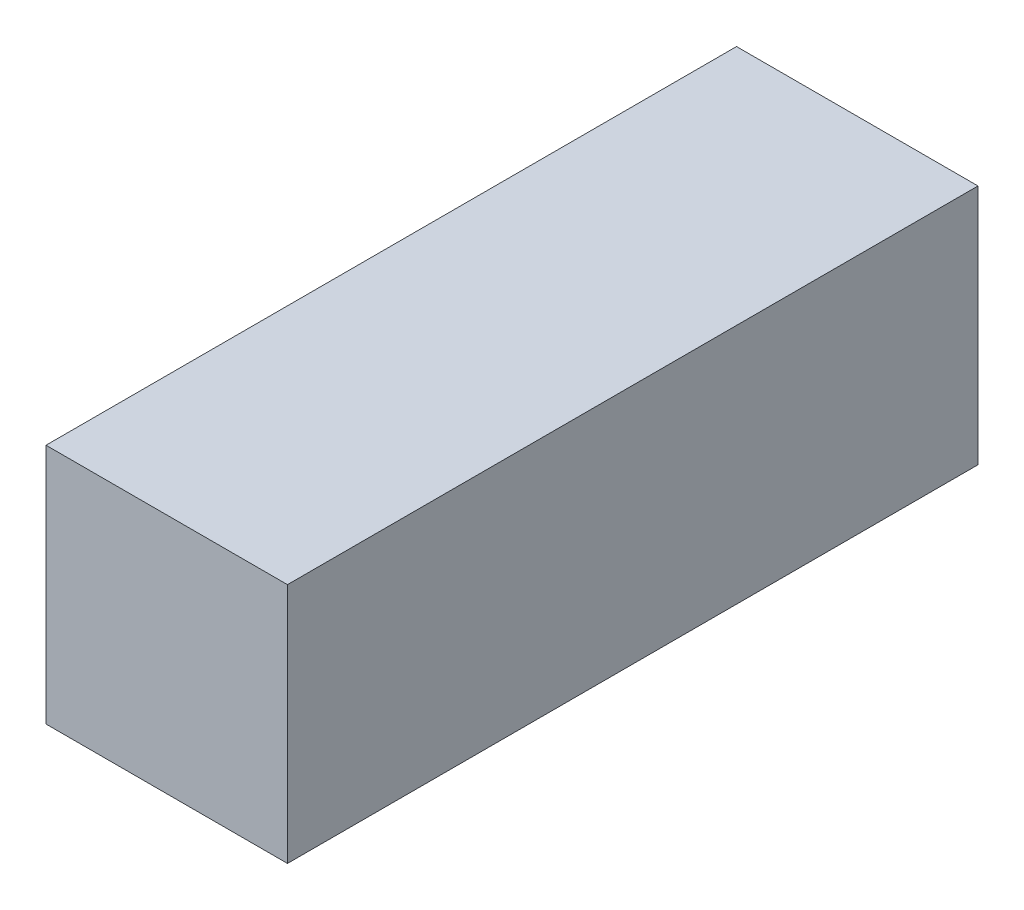
from build123d import *

# Parameters (mm, degrees)
SKETCH1_W                = 57.15
SKETCH1_H                = 19.05
BOSS_EXTRUDE1_DEPTH      = 9.525
CUT_EXTRUDE3_DEPTH       = 32.629374859
CUT_EXTRUDE3_DEPTH_BACK  = 32.629374859
SKETCH2_OUTSIDE_W        = 71.786
SKETCH2_OUTSIDE_H        = 33.686
SKETCH7_R                = 6.604
CUT_EXTRUDE6_DEPTH       = 6.477
SKETCH11_R               = 6.604
CUT_EXTRUDE10_DEPTH      = 1.6764
SKETCH8_R                = 6.604
CUT_EXTRUDE7_DEPTH       = 3.556
CUT_EXTRUDE8_START       = -3.556
SKETCH9_R                = 6.604
CUT_EXTRUDE8_DEPTH       = 3.556
CUT_EXTRUDE9_DEPTH       = 32.629374859
CUT_EXTRUDE9_DEPTH_BACK  = 32.629374859
SKETCH10_R               = 1.5875
SKETCH10_R_2             = 3.175
CUT_EXTRUDE11_DEPTH      = 32.629374859
CUT_EXTRUDE11_DEPTH_BACK = 32.629374859
SKETCH12_W               = 3.3528
SKETCH12_H               = 6.477
CUT_EXTRUDE12_DEPTH      = 32.629374859
CUT_EXTRUDE12_DEPTH_BACK = 32.629374859
SKETCH13_R               = 0.79375
SKETCH13_W               = 24.984827435
SKETCH13_H               = 3.3528
CUT_EXTRUDE13_DEPTH      = 1.5875
CUT_EXTRUDE14_DEPTH      = 32.629374859
CUT_EXTRUDE14_DEPTH_BACK = 32.629374859
SKETCH16_R               = 0.79375
FILLET1_R                = 3.175
CUT_EXTRUDE15_DEPTH      = 32.62937489
CUT_EXTRUDE15_DEPTH_BACK = 32.62937489
SKETCH18_W               = 3.3528
SKETCH18_H               = 3.175
SKETCH19_R               = 6.604
CUT_EXTRUDE16_DEPTH      = 2.667
SKETCH20_W               = 72.636985126
SKETCH20_H               = 25.4
BOSS_EXTRUDE2_DEPTH      = 25.4


with BuildPart() as part:
    # Sketch1 → Boss-Extrude1 (new, symmetric)
    with BuildSketch(Plane(origin=(0, 0, 0), x_dir=(0, 0, -1), z_dir=(1, 0, 0))):
        with Locations((0, 0.127)):
            Rectangle(SKETCH1_W, SKETCH1_H)
    extrude(amount=BOSS_EXTRUDE1_DEPTH, both=True)

    # Sketch2 outside → Cut-Extrude3 (cut, two sides: drawn at the far end of the back side and taken through both)
    with BuildSketch(Plane(origin=(0, 0, 0), x_dir=(0, 0, -1), z_dir=(1, 0, 0)).offset(-CUT_EXTRUDE3_DEPTH_BACK)):
        with Locations((0, 0.127)):
            Rectangle(SKETCH2_OUTSIDE_W, SKETCH2_OUTSIDE_H)
        with BuildLine():
            Line((-17.734871939, -4.490128061), (-12.827, -9.398))
            Line((-12.827, -9.398), (12.827, -9.398))
            Line((12.827, -9.398), (17.734871939, -4.490128061))
            ThreePointArc((17.734871939, -4.490128061), (28.091635031, -2.430039796), (22.225, 6.35))
            Line((22.225, 6.35), (22.225, 9.652))
            Line((22.225, 9.652), (-18.227010696, 9.652))
            Line((-18.227010696, 9.652), (-19.794960204, 5.866635031))
            ThreePointArc((-19.794960204, 5.866635031), (-28.452986531, -1.238823545), (-17.734871939, -4.490128061))
        make_face(mode=Mode.SUBTRACT)
    extrude(amount=CUT_EXTRUDE3_DEPTH + CUT_EXTRUDE3_DEPTH_BACK, mode=Mode.SUBTRACT)

    # Sketch7 → Cut-Extrude6 (cut, symmetric)
    with BuildSketch(Plane(origin=(0, 0, 0), x_dir=(0, 0, -1), z_dir=(1, 0, 0))):
        with Locations((22.225, 0)):
            Circle(SKETCH7_R)
    extrude(amount=CUT_EXTRUDE6_DEPTH, both=True, mode=Mode.SUBTRACT)

    # Sketch11 → Cut-Extrude10 (cut, symmetric)
    with BuildSketch(Plane(origin=(0, 0, 0), x_dir=(0, 0, -1), z_dir=(1, 0, 0))):
        with Locations((-22.225, 0)):
            Circle(SKETCH11_R)
    extrude(amount=CUT_EXTRUDE10_DEPTH, both=True, mode=Mode.SUBTRACT)

    # Sketch8 → Cut-Extrude7 (cut)
    with BuildSketch(Plane(origin=(9.525, 0, 0), x_dir=(0, 0, -1), z_dir=(1, 0, 0))):
        with Locations((-22.225, 0)):
            Circle(SKETCH8_R)
    extrude(amount=-CUT_EXTRUDE7_DEPTH, mode=Mode.SUBTRACT)

    # Sketch9 → Cut-Extrude8 (cut)
    with BuildSketch(Plane.ZY.offset(9.525).offset(CUT_EXTRUDE8_START)):
        with Locations((22.225, 0)):
            Circle(SKETCH9_R)
    extrude(amount=CUT_EXTRUDE8_DEPTH, mode=Mode.SUBTRACT)

    # Sketch10 → Cut-Extrude9 (cut, two sides: drawn at the far end of the back side and taken through both)
    with BuildSketch(Plane(origin=(0, 0, 0), x_dir=(0, 0, -1), z_dir=(1, 0, 0)).offset(-CUT_EXTRUDE9_DEPTH_BACK)):
        with Locations((-22.225, 0)):
            Circle(SKETCH10_R)
        with Locations((22.225, 0)):
            Circle(SKETCH10_R_2)
    extrude(amount=CUT_EXTRUDE9_DEPTH + CUT_EXTRUDE9_DEPTH_BACK, mode=Mode.SUBTRACT)

    # Sketch12 → Cut-Extrude11 (cut, two sides: drawn at the far end of the back side and taken through both)
    with BuildSketch(Plane.XY.offset(-CUT_EXTRUDE11_DEPTH_BACK)):
        with Locations((0, 6.4135)):
            Rectangle(SKETCH12_W, SKETCH12_H)
    extrude(amount=CUT_EXTRUDE11_DEPTH + CUT_EXTRUDE11_DEPTH_BACK, mode=Mode.SUBTRACT)

    # Sketch13 → Cut-Extrude12 (cut, two sides: drawn at the far end of the back side and taken through both)
    with BuildSketch(Plane(origin=(0, 0, 0), x_dir=(0, 0, -1), z_dir=(1, 0, 0)).offset(-CUT_EXTRUDE12_DEPTH_BACK)):
        with Locations((-14.01279023, 4.7625)):
            Circle(SKETCH13_R)
        with Locations((-0.080586282, 4.7625)):
            Rectangle(SKETCH13_W, SKETCH13_H)
    extrude(amount=CUT_EXTRUDE12_DEPTH + CUT_EXTRUDE12_DEPTH_BACK, mode=Mode.SUBTRACT)

    # Sketch14 → Cut-Extrude13 (cut, symmetric)
    with BuildSketch(Plane(origin=(0, 0, 0), x_dir=(0, 0, -1), z_dir=(1, 0, 0))):
        Polygon((-15.875, -6.35), (-12.827, -9.398), (12.827, -9.398), (15.875, -6.35), align=None)
    extrude(amount=CUT_EXTRUDE13_DEPTH, both=True, mode=Mode.SUBTRACT)

    # Sketch16 → Cut-Extrude14 (cut, two sides: drawn at the far end of the back side and taken through both)
    with BuildSketch(Plane(origin=(0, 0, 0), x_dir=(0, 0, -1), z_dir=(1, 0, 0)).offset(-CUT_EXTRUDE14_DEPTH_BACK)):
        with Locations((-12.827, -7.9375)):
            Circle(SKETCH16_R)
        with Locations((12.827, -7.9375)):
            Circle(SKETCH16_R)
    extrude(amount=CUT_EXTRUDE14_DEPTH + CUT_EXTRUDE14_DEPTH_BACK, mode=Mode.SUBTRACT)

    # Fillet1
    # the kernel refuses this fillet: 3.175 mm, written as the material it takes off along each edge
    with BuildSketch(Plane(origin=(-9.525, 9.652, 26.164510696), x_dir=(1, 0, 0), z_dir=(0, 0, -1)), Plane(origin=(9.525, 9.652, 26.164510696), x_dir=(0, -1, 0), z_dir=(0, 0, -1))) as fillet1_piece_1:
        with BuildLine():
            CenterArc((FILLET1_R, FILLET1_R), FILLET1_R, 180, 90)
            Line((0, FILLET1_R), (0, 0))
            Line((0, 0), (FILLET1_R, 0))
        make_face()
    extrude(amount=56.327010696, mode=Mode.SUBTRACT)
    with BuildSketch(Plane(origin=(-9.525, -9.398, -20.7645), x_dir=(0, 1, 0), z_dir=(0, 0, 1)), Plane(origin=(9.525, -9.398, -20.7645), x_dir=(-1, 0, 0), z_dir=(0, 0, 1))) as fillet1_piece_2:
        with BuildLine():
            CenterArc((FILLET1_R, -FILLET1_R), FILLET1_R, 90, 90)
            Line((0, -FILLET1_R), (0, 0))
            Line((0, 0), (FILLET1_R, 0))
        make_face()
    extrude(amount=41.529, mode=Mode.SUBTRACT)

    # Sketch18 → Cut-Extrude15 (cut, two sides: drawn at the far end of the back side and taken through both)
    with BuildSketch(Plane.XY.offset(-CUT_EXTRUDE15_DEPTH_BACK)):
        with Locations((0, 1.5875)):
            Rectangle(SKETCH18_W, SKETCH18_H)
    extrude(amount=CUT_EXTRUDE15_DEPTH + CUT_EXTRUDE15_DEPTH_BACK, mode=Mode.SUBTRACT)

    # Sketch19 → Cut-Extrude16 (cut, symmetric)
    with BuildSketch(Plane(origin=(0, 0, 0), x_dir=(0, 0, -1), z_dir=(1, 0, 0))):
        with Locations((-22.225, 0)):
            Circle(SKETCH19_R)
    extrude(amount=CUT_EXTRUDE16_DEPTH, both=True, mode=Mode.SUBTRACT)


with BuildPart() as body_2:
    # Sketch20 → Boss-Extrude2 (new body)
    with BuildSketch(Plane.ZY.offset(9.525)):
        with Locations((-7.743492563, -3.048)):
            Rectangle(SKETCH20_W, SKETCH20_H)
    extrude(amount=-BOSS_EXTRUDE2_DEPTH)


solid = Compound([part.part, body_2.part])
